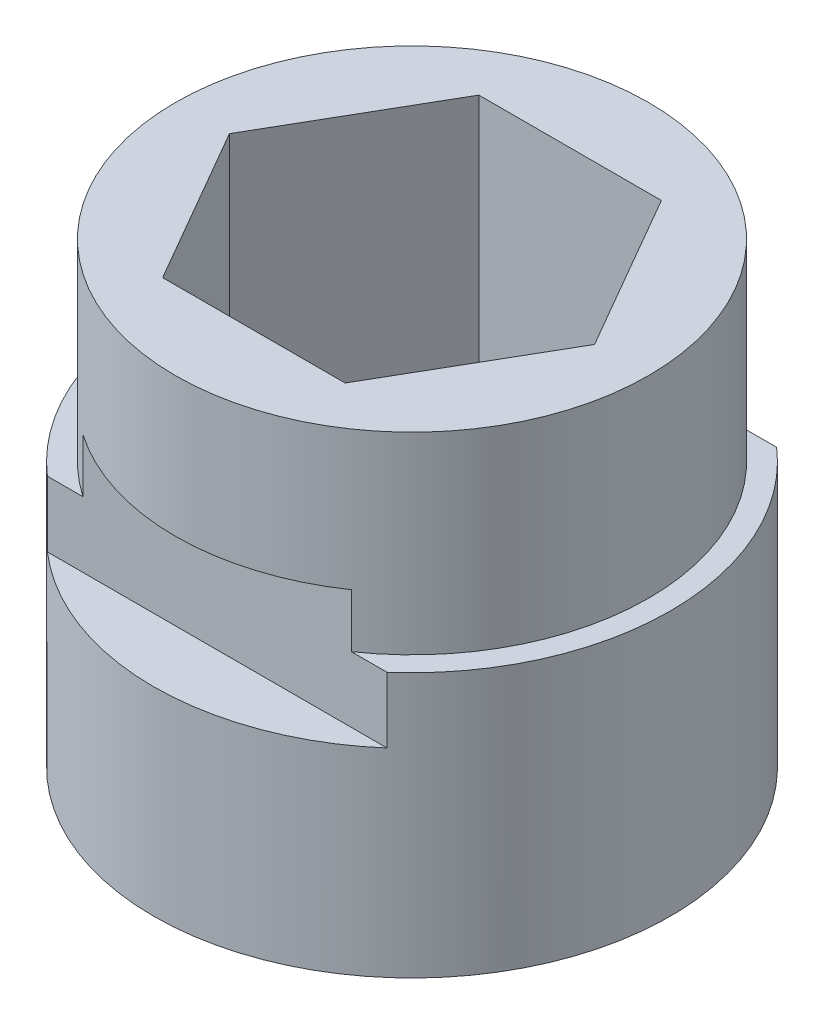
from build123d import *

# Parameters (mm, degrees)
SKETCH1_R               = 7.5565
BOSS_EXTRUDE1_DEPTH     = 13.97
BOSS_EXTRUDE2_START     = 0.635
SKETCH2_R               = 7.5565
SKETCH2_R_2             = 3.3
BOSS_EXTRUDE2_DEPTH     = 0.635
SKETCH4_R               = 8.255
SKETCH4_R_2             = 7.5565
BOSS_EXTRUDE3_DEPTH     = 8.4455
CUT_EXTRUDE1_DEPTH      = 19.205794407
CUT_EXTRUDE1_DEPTH_BACK = 19.205794407
SKETCH3_W               = 2.572814656
SKETCH3_H               = 3.81
SKETCH3_W_2             = 2.256055482


with BuildPart() as part:
    # Sketch1 → Boss-Extrude1 (new body)
    with BuildSketch(Plane(origin=(0, 0, 0), x_dir=(1, 0, 0), z_dir=(0, 1, 0))):
        Circle(SKETCH1_R)
        Polygon((-2.915618859, 5.05), (-5.831237719, 0), (-2.915618859, -5.05), (2.915618859, -5.05), (5.831237719, 0), (2.915618859, 5.05), align=None, mode=Mode.SUBTRACT)
    extrude(amount=BOSS_EXTRUDE1_DEPTH)

    # Sketch2 → Boss-Extrude2 (add)
    with BuildSketch(Plane.XZ.offset(BOSS_EXTRUDE2_START)):
        Circle(SKETCH2_R)
        Circle(SKETCH2_R_2, mode=Mode.SUBTRACT)
    extrude(amount=-BOSS_EXTRUDE2_DEPTH)

    # Sketch4 → Boss-Extrude3 (add)
    with BuildSketch(Plane.XZ.offset(0.635)):
        Circle(SKETCH4_R)
        Circle(SKETCH4_R_2, mode=Mode.SUBTRACT)
    extrude(amount=-BOSS_EXTRUDE3_DEPTH)

    # Sketch3 → Cut-Extrude1 (cut, two sides: drawn at the far end of the back side and taken through both)
    with BuildSketch(Plane(origin=(0, 0, 0), x_dir=(0, 0, -1), z_dir=(1, 0, 0)).offset(-CUT_EXTRUDE1_DEPTH_BACK)):
        with Locations((-7.509407328, 7.62)):
            Rectangle(SKETCH3_W, SKETCH3_H)
        with Locations((7.351027741, 7.62)):
            Rectangle(SKETCH3_W_2, SKETCH3_H)
    extrude(amount=CUT_EXTRUDE1_DEPTH + CUT_EXTRUDE1_DEPTH_BACK, mode=Mode.SUBTRACT)


solid = part.part
